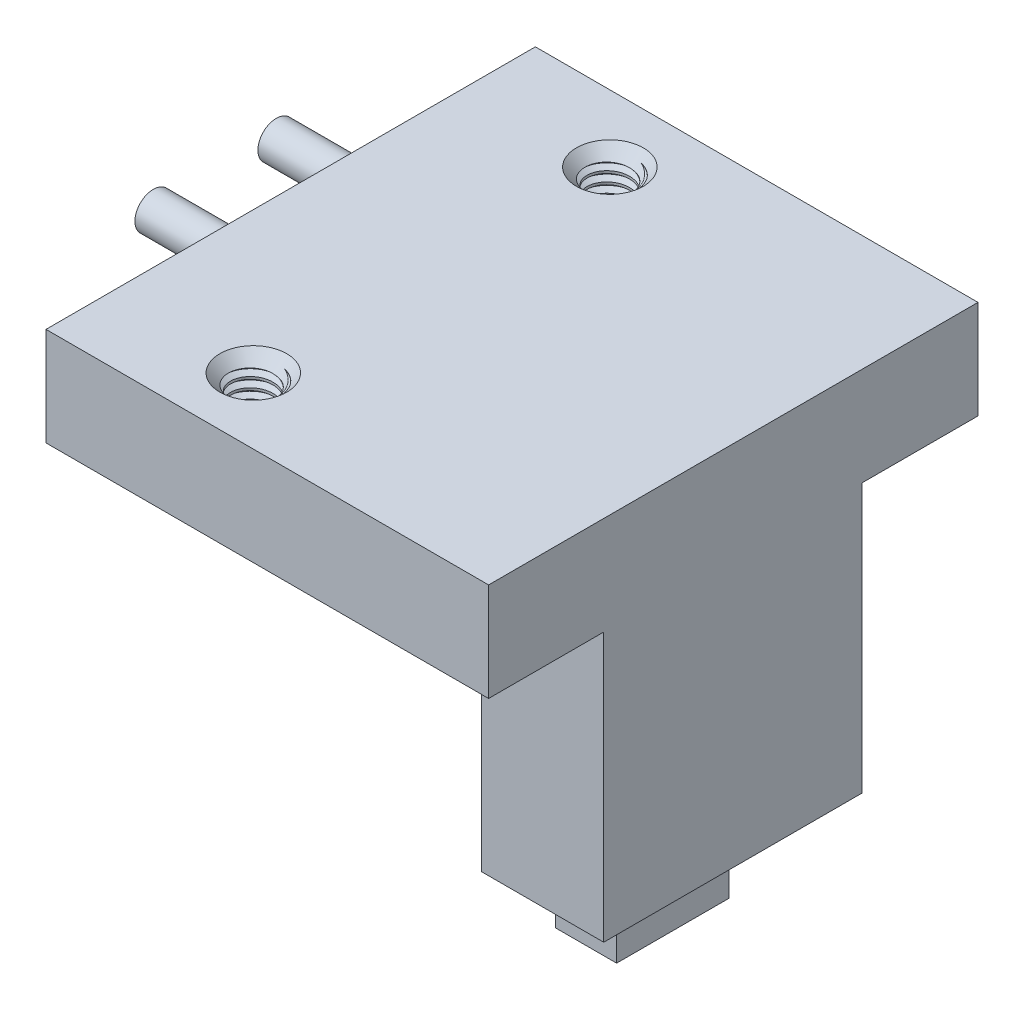
from build123d import *

# Parameters (mm, degrees)
SKETCH1_W                       = 36
SKETCH1_H                       = 37
BOSS_EXTRUDE1_DEPTH             = 5
SKETCH2_W                       = 36
SKETCH2_H                       = 8
BOSS_EXTRUDE2_DEPTH             = 3
SKETCH3_R                       = 1.5
BOSS_EXTRUDE3_DEPTH             = 6
SKETCH18_W                      = 9.95413856
SKETCH18_H                      = 21
BOSS_EXTRUDE8_DEPTH             = 24.85
SKETCH19_W                      = 4.95413856
SKETCH19_H                      = 9.15
BOSS_EXTRUDE9_DEPTH             = 7
F_8_32_TAPPED_HOLE2_D           = 3.4544
F_8_32_TAPPED_HOLE2_DEPTH       = 10.962193539
F_8_32_TAPPED_HOLE2_CSINK_D     = 5.4356
F_8_32_TAPPED_HOLE2_CSINK_ANGLE = 90
F_8_32_TAPPED_HOLE2_TIP         = 1.037806461
THREAD4_PITCH                   = 0.79375
THREAD5_PITCH                   = 0.79375
SKETCH20_W                      = 36
SKETCH20_H                      = 1.442276569
SKETCH20_H_2                    = 1.361012463
BOSS_EXTRUDE10_DEPTH            = 8


with BuildPart() as part:
    # Sketch1 → Boss-Extrude1 (new body)
    with BuildSketch(Plane(origin=(0, 0, 0), x_dir=(1, 0, 0), z_dir=(0, 1, 0))):
        with Locations((4.082129674, 12.725585003)):
            Rectangle(SKETCH1_W, SKETCH1_H)
    extrude(amount=BOSS_EXTRUDE1_DEPTH)

    # Sketch2 → Boss-Extrude2 (add)
    with BuildSketch(Plane.XZ):
        with Locations((4.082129674, -27.225585003)):
            Rectangle(SKETCH2_W, SKETCH2_H)
        with Locations((4.082129674, 1.774414997)):
            Rectangle(SKETCH2_W, SKETCH2_H)
    extrude(amount=BOSS_EXTRUDE2_DEPTH)

    # Sketch3 → Boss-Extrude3 (add)
    with BuildSketch(Plane.ZY.offset(13.917870326)):
        with Locations(Location((-17.595585003, 3, 0), (0, 0, 180))):
            Circle(SKETCH3_R)
        with Locations(Location((-7.595585003, 3, 0), (0, 0, 180))):
            Circle(SKETCH3_R)
    extrude(amount=BOSS_EXTRUDE3_DEPTH)

    # Sketch18 → Boss-Extrude8 (add)
    with BuildSketch(Plane.XZ):
        with Locations((17.105060394, -12.725585003)):
            Rectangle(SKETCH18_W, SKETCH18_H)
    extrude(amount=BOSS_EXTRUDE8_DEPTH)

    # Sketch19 → Boss-Extrude9 (add)
    with BuildSketch(Plane.XZ.offset(24.85)):
        with Locations((14.605060394, -12.850585003)):
            Rectangle(SKETCH19_W, SKETCH19_H)
    extrude(amount=BOSS_EXTRUDE9_DEPTH)

    # #8-32 Tapped Hole2
    with Locations(Plane(origin=(0, 5, 0), x_dir=(1, 0, 0), z_dir=(0, 1, 0))):
        with Locations((-2.417870326, 27.225585003), (-2.417870326, -1.774414997)):
            CounterSinkHole(F_8_32_TAPPED_HOLE2_D / 2, F_8_32_TAPPED_HOLE2_CSINK_D / 2, depth=F_8_32_TAPPED_HOLE2_DEPTH, counter_sink_angle=F_8_32_TAPPED_HOLE2_CSINK_ANGLE)
            with Locations((0, 0, -(F_8_32_TAPPED_HOLE2_DEPTH + F_8_32_TAPPED_HOLE2_TIP / 2))):  # 118° drill point
                Cone(0, F_8_32_TAPPED_HOLE2_D / 2, F_8_32_TAPPED_HOLE2_TIP, mode=Mode.SUBTRACT)

    # Thread4: the profile of Thread Profile10 profile screwed along a right-hand helix of 12.598425 turns, 8 arcs to a turn; built about Z, then put on its axis
    thread4_z = Axis((0, 0, 0), (0, 0, 1))
    thread4_corners = [(1.7269, 0, -0.000173205), (2.156829789, 0, 0.248046874), (2.156829789, 0, 0.347265624), (1.7269, 0, 0.595485703)]
    with BuildLine(mode=Mode.PRIVATE) as thread4_profile:
        Line(thread4_corners[0], thread4_corners[1])
        Line(thread4_corners[1], thread4_corners[2])
        Line(thread4_corners[2], thread4_corners[3])
        Line(thread4_corners[3], thread4_corners[0])
    thread4_cap = Face(thread4_profile.wire())
    thread4_turn_angles = [0, 22.5, 45, 67.5, 90, 112.5, 135, 157.5, 180, 202.5, 225, 247.5, 270, 292.5, 315, 337.5, 360]
    thread4_turn_weights = [1, 0.9238795325112867, 1, 0.9238795325112867, 1, 0.9238795325112867, 1, 0.9238795325112867, 1, 0.9238795325112867, 1, 0.9238795325112867, 1, 0.9238795325112867, 1, 0.9238795325112867, 1]
    thread4_turn_rails = [Edge.make_bspline([Vector(p[0], p[1], 0).rotate(thread4_z, thread4_turn_angles[k]) / thread4_turn_weights[k] + Vector(0, 0, p[2] + THREAD4_PITCH * thread4_turn_angles[k] / 360) for k in range(17)], [0, 0, 0, 1, 1, 2, 2, 3, 3, 4, 4, 5, 5, 6, 6, 7, 7, 8, 8, 8], 2, thread4_turn_weights) for p in thread4_corners]
    thread4_turn_sides = [Face.make_surface_from_curves(thread4_turn_rails[p[0]], thread4_turn_rails[p[1]]) for p in [(0, 1), (1, 2), (2, 3), (3, 0)]]
    thread4_last_angles = [4320, 4342.5, 4365, 4387.5, 4410, 4432.5, 4455, 4477.5, 4500, 4517.716535433, 4535.433070866]
    thread4_last_weights = [1, 0.9238795325112867, 1, 0.9238795325112867, 1, 0.9238795325112867, 1, 0.9238795325112867, 1, 0.9525736983244454, 1]
    thread4_last_rails = [Edge.make_bspline([Vector(p[0], p[1], 0).rotate(thread4_z, thread4_last_angles[k]) / thread4_last_weights[k] + Vector(0, 0, p[2] + THREAD4_PITCH * thread4_last_angles[k] / 360) for k in range(11)], [0, 0, 0, 1, 1, 2, 2, 3, 3, 4, 4, 5, 5, 5], 2, thread4_last_weights) for p in thread4_corners]
    thread4_last_sides = [Face.make_surface_from_curves(thread4_last_rails[p[0]], thread4_last_rails[p[1]]) for p in [(0, 1), (1, 2), (2, 3), (3, 0)]]
    thread4 = Plane(origin=(-2.417870326, 5.0094, -27.225585003), x_dir=(-1, 0, 0), z_dir=(0, -1, 0)) * Solid(Shell([*[p.moved(Location((0, 0, THREAD4_PITCH * i))) for i in range(12) for p in thread4_turn_sides], *thread4_last_sides, thread4_cap, thread4_cap.rotate(thread4_z, 4535.433070866).moved(Location((0, 0, THREAD4_PITCH * 4535.433070866 / 360)))]))
    add(thread4, mode=Mode.SUBTRACT)

    # Thread5: the profile of Thread Profile11 profile screwed along a right-hand helix of 12.598425 turns, 8 arcs to a turn; built about Z, then put on its axis
    thread5_z = Axis((0, 0, 0), (0, 0, 1))
    thread5_corners = [(1.7269, 0, -0.000173205), (2.156829789, 0, 0.248046874), (2.156829789, 0, 0.347265624), (1.7269, 0, 0.595485703)]
    with BuildLine(mode=Mode.PRIVATE) as thread5_profile:
        Line(thread5_corners[0], thread5_corners[1])
        Line(thread5_corners[1], thread5_corners[2])
        Line(thread5_corners[2], thread5_corners[3])
        Line(thread5_corners[3], thread5_corners[0])
    thread5_cap = Face(thread5_profile.wire())
    thread5_turn_angles = [0, 22.5, 45, 67.5, 90, 112.5, 135, 157.5, 180, 202.5, 225, 247.5, 270, 292.5, 315, 337.5, 360]
    thread5_turn_weights = [1, 0.9238795325112867, 1, 0.9238795325112867, 1, 0.9238795325112867, 1, 0.9238795325112867, 1, 0.9238795325112867, 1, 0.9238795325112867, 1, 0.9238795325112867, 1, 0.9238795325112867, 1]
    thread5_turn_rails = [Edge.make_bspline([Vector(p[0], p[1], 0).rotate(thread5_z, thread5_turn_angles[k]) / thread5_turn_weights[k] + Vector(0, 0, p[2] + THREAD5_PITCH * thread5_turn_angles[k] / 360) for k in range(17)], [0, 0, 0, 1, 1, 2, 2, 3, 3, 4, 4, 5, 5, 6, 6, 7, 7, 8, 8, 8], 2, thread5_turn_weights) for p in thread5_corners]
    thread5_turn_sides = [Face.make_surface_from_curves(thread5_turn_rails[p[0]], thread5_turn_rails[p[1]]) for p in [(0, 1), (1, 2), (2, 3), (3, 0)]]
    thread5_last_angles = [4320, 4342.5, 4365, 4387.5, 4410, 4432.5, 4455, 4477.5, 4500, 4517.716535433, 4535.433070866]
    thread5_last_weights = [1, 0.9238795325112867, 1, 0.9238795325112867, 1, 0.9238795325112867, 1, 0.9238795325112867, 1, 0.9525736983244454, 1]
    thread5_last_rails = [Edge.make_bspline([Vector(p[0], p[1], 0).rotate(thread5_z, thread5_last_angles[k]) / thread5_last_weights[k] + Vector(0, 0, p[2] + THREAD5_PITCH * thread5_last_angles[k] / 360) for k in range(11)], [0, 0, 0, 1, 1, 2, 2, 3, 3, 4, 4, 5, 5, 5], 2, thread5_last_weights) for p in thread5_corners]
    thread5_last_sides = [Face.make_surface_from_curves(thread5_last_rails[p[0]], thread5_last_rails[p[1]]) for p in [(0, 1), (1, 2), (2, 3), (3, 0)]]
    thread5 = Plane(origin=(-2.417870326, 5.0094, 1.774414997), x_dir=(-1, 0, 0), z_dir=(0, -1, 0)) * Solid(Shell([*[p.moved(Location((0, 0, THREAD5_PITCH * i))) for i in range(12) for p in thread5_turn_sides], *thread5_last_sides, thread5_cap, thread5_cap.rotate(thread5_z, 4535.433070866).moved(Location((0, 0, THREAD5_PITCH * 4535.433070866 / 360)))]))
    add(thread5, mode=Mode.SUBTRACT)

    # Sketch20 → Boss-Extrude10 (add)
    with BuildSketch(Plane(origin=(0, 5, 0), x_dir=(1, 0, 0), z_dir=(0, 1, 0))):
        with Locations((4.082129674, 31.946723287)):
            Rectangle(SKETCH20_W, SKETCH20_H)
        with Locations((4.082129674, -6.454921228)):
            Rectangle(SKETCH20_W, SKETCH20_H_2)
    extrude(amount=-BOSS_EXTRUDE10_DEPTH)


solid = part.part
